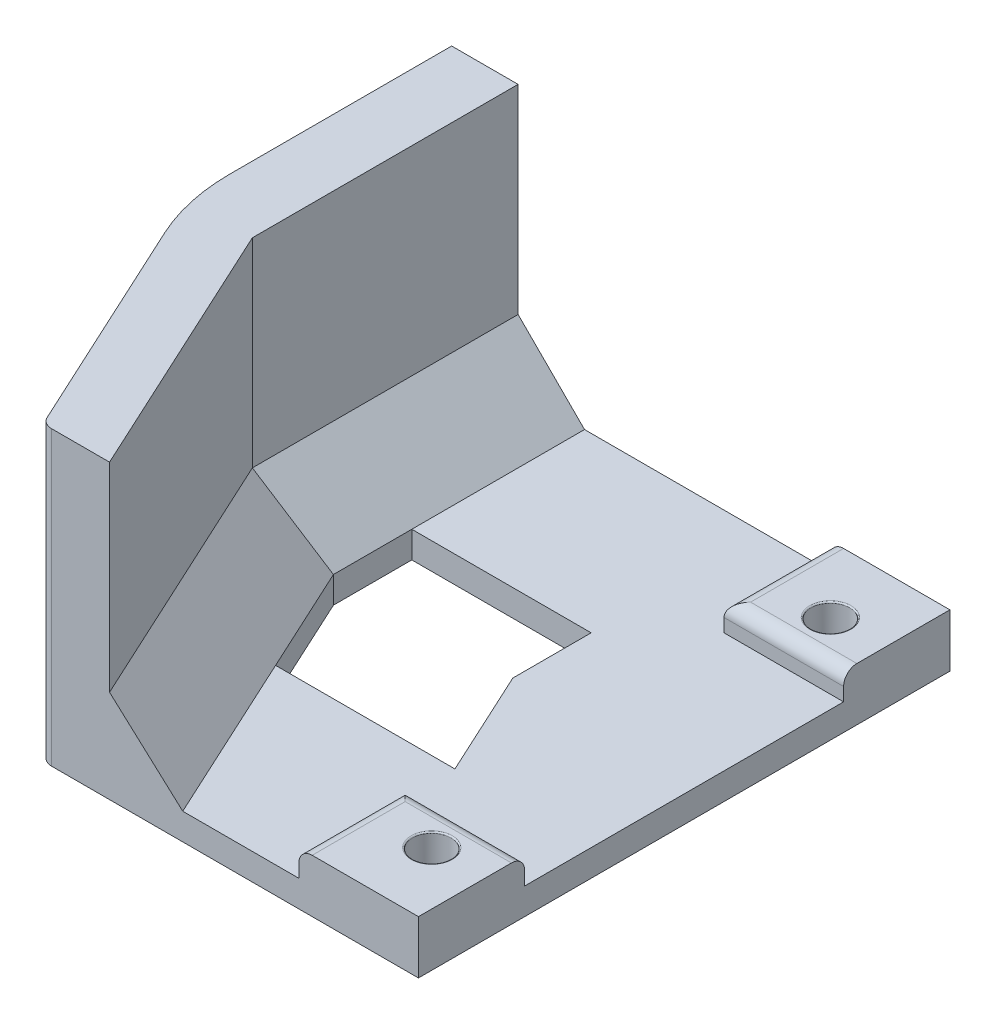
from build123d import *

# Parameters (mm, degrees)
SKETCH_1_W               = 57
SKETCH_1_H               = 80
EXTRUDE_1_DEPTH          = 4
EXTRUDE_2_DEPTH          = 40
CUT_EXTRUDE_1_DEPTH      = 16
SKETCH_4_W               = 80
SKETCH_4_H               = 4
EXTRUDE_3_DEPTH          = 20
SKETCH_7_W               = 20
SKETCH_7_H               = 80
EXTRUDE_4_DEPTH          = 4
CUT_EXTRUDE_2_DEPTH      = 4
CUT_EXTRUDE_2_DEPTH_BACK = 4
SKETCH_5_R               = 1.45
SKETCH_8_R               = 2.9
CUT_EXTRUDE_3_DEPTH      = 6
SKETCH_9_W               = 80
SKETCH_9_H               = 8
CUT_EXTRUDE_4_DEPTH      = 2
SKETCH_10_W              = 18
SKETCH_10_H              = 48
CUT_EXTRUDE_5_DEPTH      = 4
CUT_EXTRUDE_6_DEPTH      = 4
CHAMFER_1_SIZE           = 10
FILLET_1_R               = 30
FILLET_2_R               = 2
FILLET_3_R               = 0.2


with BuildPart() as part:
    # 草图1 → 凸台-拉伸1 (new body)
    with BuildSketch(Plane(origin=(0, 0, 0), x_dir=(1, 0, 0), z_dir=(0, 1, 0))):
        with Locations((-28.5, 40)):
            Rectangle(SKETCH_1_W, SKETCH_1_H)
    extrude(amount=EXTRUDE_1_DEPTH)

    # 草图2 → 凸台-拉伸2 (add)
    with BuildSketch(Plane(origin=(0, 4, 0), x_dir=(1, 0, 0), z_dir=(0, 1, 0))):
        Polygon((-47, 40), (-28.5, 0), (-38.5, 0), (-57, 40), (-57, 80), (-47, 80), align=None)
    extrude(amount=EXTRUDE_2_DEPTH)

    # 草图3 → 切除-拉伸1 (cut)
    with BuildSketch(Plane(origin=(0, 4, 0), x_dir=(1, 0, 0), z_dir=(0, 1, 0))):
        Polygon((-38.5, 0), (-57, 40), (-57, 0), align=None)
    extrude(amount=-CUT_EXTRUDE_1_DEPTH, mode=Mode.SUBTRACT)

    # 草图4 → 凸台-拉伸3 (add)
    with BuildSketch(Plane(origin=(0, 0, 0), x_dir=(0, 0, -1), z_dir=(1, 0, 0))):
        with Locations((40, 2)):
            Rectangle(SKETCH_4_W, SKETCH_4_H)
    extrude(amount=EXTRUDE_3_DEPTH)

    # 草图7 → 凸台-拉伸4 (add)
    with BuildSketch(Plane(origin=(0, 4, 0), x_dir=(1, 0, 0), z_dir=(0, 1, 0))):
        with Locations((10, 40)):
            Rectangle(SKETCH_7_W, SKETCH_7_H)
    extrude(amount=EXTRUDE_4_DEPTH)

    # 草图5 → 切除-拉伸2 (cut, two sides: drawn at the far end of the back side and taken through both)
    with BuildSketch(Plane(origin=(0, 4, 0), x_dir=(1, 0, 0), z_dir=(0, 1, 0)).offset(-CUT_EXTRUDE_2_DEPTH_BACK)):
        with Locations(Location((10, 70, 0), (0, 0, 270))):
            Circle(SKETCH_5_R)
        with Locations(Location((10, 10, 0), (0, 0, 90))):
            Circle(SKETCH_5_R)
    extrude(amount=CUT_EXTRUDE_2_DEPTH + CUT_EXTRUDE_2_DEPTH_BACK, mode=Mode.SUBTRACT)

    # 草图8 → 切除-拉伸3 (cut)
    with BuildSketch(Plane(origin=(0, 8, 0), x_dir=(1, 0, 0), z_dir=(0, 1, 0))):
        with Locations(Location((10, 70, 0), (0, 0, 270))):
            Circle(SKETCH_8_R)
        with Locations(Location((10, 10, 0), (0, 0, 270))):
            Circle(SKETCH_8_R)
    extrude(amount=-CUT_EXTRUDE_3_DEPTH, mode=Mode.SUBTRACT)

    # 草图9 → 切除-拉伸4 (cut)
    with BuildSketch(Plane(origin=(20, 0, 0), x_dir=(0, 0, -1), z_dir=(1, 0, 0))):
        with Locations((40, 4)):
            Rectangle(SKETCH_9_W, SKETCH_9_H)
    extrude(amount=-CUT_EXTRUDE_4_DEPTH, mode=Mode.SUBTRACT)

    # 草图10 → 切除-拉伸5 (cut)
    with BuildSketch(Plane(origin=(0, 8, 0), x_dir=(1, 0, 0), z_dir=(0, 1, 0))):
        with Locations((9, 40)):
            Rectangle(SKETCH_10_W, SKETCH_10_H)
    extrude(amount=-CUT_EXTRUDE_5_DEPTH, mode=Mode.SUBTRACT)

    # 草图11 → 切除-拉伸6 (cut)
    with BuildSketch(Plane(origin=(0, 4, 0), x_dir=(1, 0, 0), z_dir=(0, 1, 0))):
        Polygon((-37, 42.200521891), (-29.507258625, 26), (-2.507258625, 26), (-10, 42.200521891), (-10, 54), (-37, 54), align=None)
    extrude(amount=-CUT_EXTRUDE_6_DEPTH, mode=Mode.SUBTRACT)

    # 倒角1
    chamfer_1_edges = [part.edges().sort_by_distance(p)[0] for p in [
        (-37.75, 4, -20),
        (-47, 4, -60),
    ]]
    chamfer(chamfer_1_edges, length=CHAMFER_1_SIZE - 0.0001)  # a hair under: the kernel refuses the full size

    # 圆角1
    fillet_1_edges = [part.edges().sort_by_distance(p)[0] for p in [
        (-57, 22, -40),
    ]]
    fillet(fillet_1_edges, radius=FILLET_1_R)

    # 圆角2
    fillet_2_edges = [part.edges().sort_by_distance(p)[0] for p in [
        (0, 8, -8),
        (9, 8, -16),
        (9, 8, -64),
        (-38.5, 22, 0),
        (0, 8, -72),
    ]]
    fillet(fillet_2_edges, radius=FILLET_2_R)

    # 圆角3
    fillet_3_edges = [part.edges().sort_by_distance(p)[0] for p in [
        (10, 2, -71.45),
        (10, 8, -72.9),
        (10, 2, -8.55),
        (10, 8, -12.9),
    ]]
    fillet(fillet_3_edges, radius=FILLET_3_R)


solid = part.part
